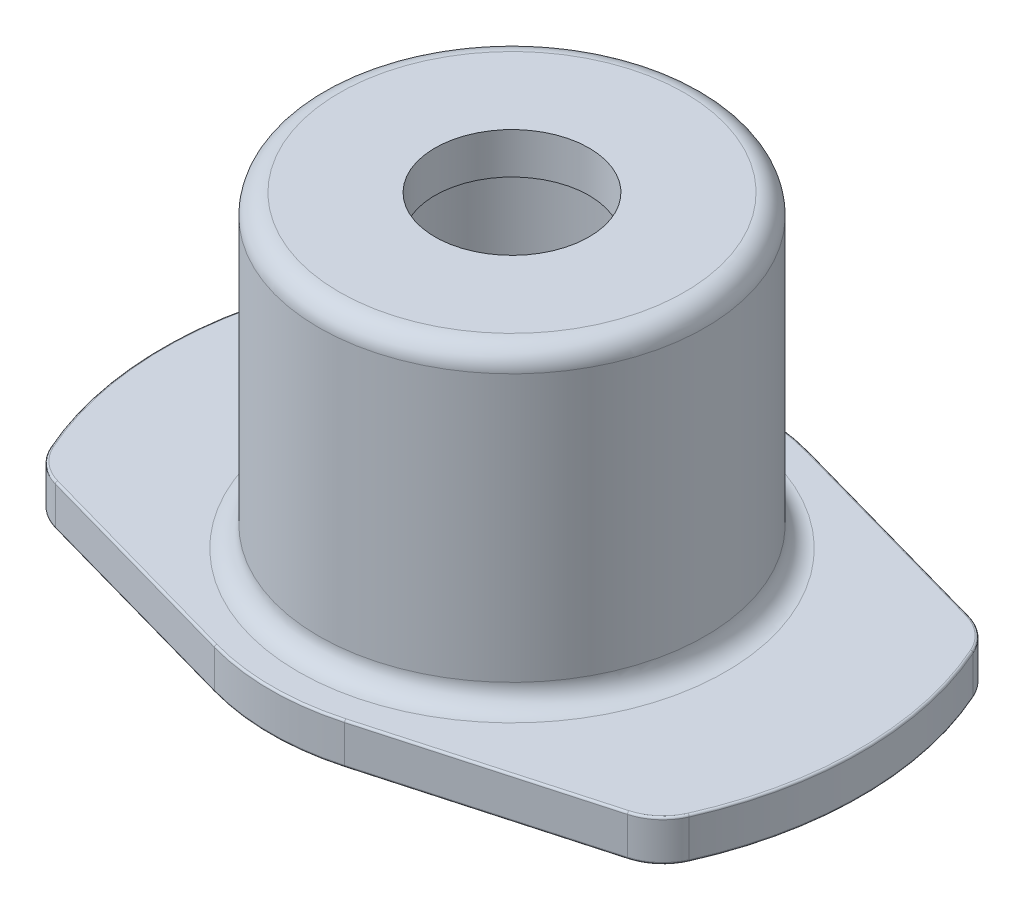
from build123d import *

# Parameters (mm, degrees)
BOSS_EXTRUDE3_DEPTH = 2
SKETCH2_R           = 9.4
BOSS_EXTRUDE2_DEPTH = 15
SKETCH3_R           = 5.105
CUT_EXTRUDE1_DEPTH  = 15
SKETCH4_R           = 3.75
CUT_EXTRUDE2_DEPTH  = 26.535514485
FILLET2_R           = 1
FILLET4_R           = 0.1


with BuildPart() as part:
    # Sketch6 → Boss-Extrude3 (new body)
    with BuildSketch(Plane(origin=(0, 0, 0), x_dir=(1, 0, 0), z_dir=(0, 1, 0))):
        with BuildLine():
            Line((-3.16984511, 11.314352919), (-13.922193144, 8.301959893))
            ThreePointArc((-13.922193144, 8.301959893), (-14.882365074, 7.78622676), (-15.531854224, 6.910969857))
            ThreePointArc((-15.531854224, 6.910969857), (-17, 0), (-15.531854224, -6.910969857))
            ThreePointArc((-15.531854224, -6.910969857), (-14.882365074, -7.78622676), (-13.922193144, -8.301959893))
            Line((-13.922193144, -8.301959893), (-3.16984511, -11.314352919))
            ThreePointArc((-3.16984511, -11.314352919), (0, -11.75), (3.16984511, -11.314352919))
            Line((3.16984511, -11.314352919), (13.922193144, -8.301959893))
            ThreePointArc((13.922193144, -8.301959893), (14.882365074, -7.78622676), (15.531854224, -6.910969857))
            ThreePointArc((15.531854224, -6.910969857), (17, 0), (15.531854224, 6.910969857))
            ThreePointArc((15.531854224, 6.910969857), (14.882365074, 7.78622676), (13.922193144, 8.301959893))
            Line((13.922193144, 8.301959893), (3.16984511, 11.314352919))
            ThreePointArc((3.16984511, 11.314352919), (0, 11.75), (-3.16984511, 11.314352919))
        make_face()
    extrude(amount=BOSS_EXTRUDE3_DEPTH)

    # Sketch2 → Boss-Extrude2 (add)
    with BuildSketch(Plane(origin=(0, 2, 0), x_dir=(1, 0, 0), z_dir=(0, 1, 0))):
        Circle(SKETCH2_R)
    extrude(amount=BOSS_EXTRUDE2_DEPTH)

    # Sketch3 → Cut-Extrude1 (cut)
    with BuildSketch(Plane.XZ):
        Circle(SKETCH3_R)
    extrude(amount=-CUT_EXTRUDE1_DEPTH, mode=Mode.SUBTRACT)

    # Sketch4 → Cut-Extrude2 (cut, through all)
    with BuildSketch(Plane.XZ.offset(-15)):
        Circle(SKETCH4_R)
    extrude(amount=-CUT_EXTRUDE2_DEPTH, mode=Mode.SUBTRACT)

    # Fillet2
    fillet2_edges = [part.edges().sort_by_distance(p)[0] for p in [
        (-9.4, 17, 0),
        (-9.4, 2, 0),
    ]]
    fillet(fillet2_edges, radius=FILLET2_R)

    # Fillet4
    fillet4_edges = [part.edges().sort_by_distance(p)[0] for p in [
        (-14.882365074, 0, 7.78622676),
        (-17, 0, 0),
        (-14.882365074, 0, -7.78622676),
        (-8.546019127, 0, -9.808156406),
        (0, 0, -11.75),
        (8.546019127, 0, -9.808156406),
        (14.882365074, 0, -7.78622676),
        (17, 0, 0),
        (14.882365074, 0, 7.78622676),
        (8.546019127, 0, 9.808156406),
        (0, 0, 11.75),
        (-14.882365074, 2, 7.78622676),
        (-17, 2, 0),
        (-14.882365074, 2, -7.78622676),
        (-8.546019127, 2, -9.808156406),
        (0, 2, -11.75),
        (8.546019127, 2, -9.808156406),
        (14.882365074, 2, -7.78622676),
        (17, 2, 0),
        (14.882365074, 2, 7.78622676),
        (8.546019127, 2, 9.808156406),
        (0, 2, 11.75),
        (-8.546019127, 0, 9.808156406),
        (-8.546019127, 2, 9.808156406),
    ]]
    fillet(fillet4_edges, radius=FILLET4_R)


solid = part.part
